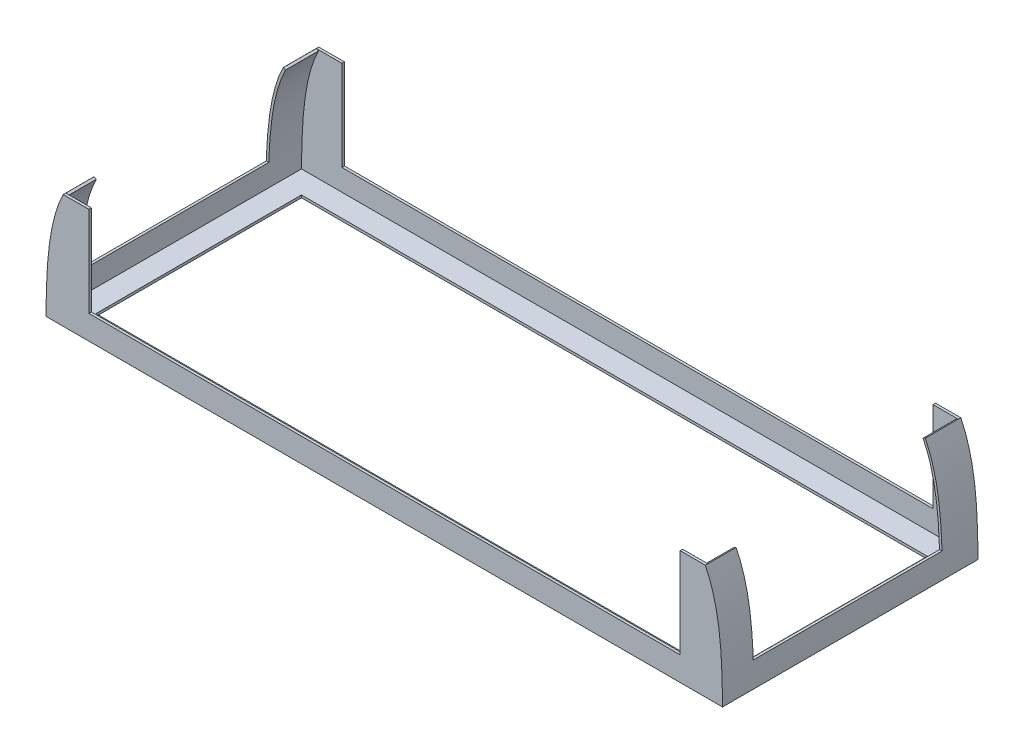
from build123d import *

# Parameters (mm, degrees)
EXTRUDE_THIN2_START    = -127
EXTRUDE_THIN2_DEPTH    = 254
SPLIT1_SURFACE_1_BACK  = 741.713
SPLIT1_SURFACE_1_DEPTH = 1483.426
BOSS_EXTRUDE2_DEPTH    = 2.54
BOSS_EXTRUDE3_DEPTH    = 2.54
SPLIT2_SURFACE_2_BACK  = 743.47
SPLIT2_SURFACE_2_DEPTH = 1486.94


# Read off the part's stored shape, not the designer's step: Extrude-Thin2
with BuildPart() as part:
    # Extrude-Thin2 outline → Extrude-Thin2 (new body)
    with BuildSketch(Plane.XY.offset(EXTRUDE_THIN2_START)):
        with BuildLine():
            Line((-325.542449195, 166.687822519), (-325.542449195, 166.669160537))
            Line((-325.542449195, 166.669160537), (-325.579794085, 166.687822519))
            add(Edge.make_bspline(
                [(-343.046678298, 50.863822519), (-342.854742326, 95.850869045), (-340.503085509, 136.824505781), (-325.579794085, 166.687822519)],
                knots=[0.396009693, 0.396009693, 0.396009693, 0.396009693, 0.524743478, 0.524743478, 0.524743478, 0.524743478], degree=3))
            Line((-343.046678298, 50.863822519), (343.046678298, 50.863822519))
            add(Edge.make_bspline(
                [(325.579794084, 166.687822519), (340.503085509, 136.824505781), (342.854742326, 95.850869045), (343.046678298, 50.863822519)],
                knots=[0.396009693, 0.396009693, 0.396009693, 0.396009693, 0.524743478, 0.524743478, 0.524743478, 0.524743478], degree=3))
            Line((325.579794084, 166.687822519), (323.307694442, 165.552409283))
            add(Edge.make_bspline(
                [(323.307694442, 165.552409283), (326.877593275, 158.408608594), (329.727019011, 150.576977672), (334.257221566, 133.733582984), (335.93764666, 124.722865717), (339.652297398, 96.250136339), (340.357498858, 75.350575466), (340.493401884, 53.403822519)],
                knots=[0, 0, 0, 0, 0.25, 0.25, 0.5, 0.5, 1, 1, 1, 1], degree=3))
            Line((340.493401884, 53.403822519), (-340.493401884, 53.403822519))
            add(Edge.make_bspline(
                [(-340.493401884, 53.403822519), (-340.357498858, 75.350575466), (-339.652297398, 96.250136339), (-335.937646661, 124.722865717), (-334.257221567, 133.733582984), (-329.727019012, 150.576977672), (-326.877593276, 158.408608594), (-323.307694443, 165.552409283)],
                knots=[0, 0, 0, 0, 0.5, 0.5, 0.75, 0.75, 1, 1, 1, 1], degree=3))
            Line((-323.307694443, 165.552409283), (-325.502746425, 166.649320276))
            Line((-325.502746425, 166.649320276), (-325.502746425, 166.687822519))
            Line((-325.502746425, 166.687822519), (-325.542449195, 166.687822519))
        make_face()
    extrude(amount=EXTRUDE_THIN2_DEPTH)

    # Split1: cut with a surface, the side behind it stays
    # Split1 surface: a surface, the sketch's curves swept straight by 1483.426 mm
    with BuildLine(Plane(origin=(0, 0, 0), x_dir=(0, 0, -1), z_dir=(1, 0, 0)).offset(-SPLIT1_SURFACE_1_BACK), mode=Mode.PRIVATE) as split1_surface_1_path:
        Line((-98.324088945, 166.687822519), (-97.98299712, 76.193733858))
        Line((-97.98299712, 76.193733858), (93.487324748, 76.104761498))
        Line((93.487324748, 76.104761498), (93.541066072, 166.687822519))
        Line((93.541066072, 166.687822519), (-98.324088945, 166.687822519))
    split1_surface_1 = Shell.extrude(split1_surface_1_path.wire(), (1 * SPLIT1_SURFACE_1_DEPTH, 0 * SPLIT1_SURFACE_1_DEPTH, 0 * SPLIT1_SURFACE_1_DEPTH))
    split(bisect_by=split1_surface_1, keep=Keep.BOTTOM)

    # Sketch6 → Boss-Extrude2 (add)
    with BuildSketch(Plane.XY.offset(129.54)):
        with BuildLine():
            Line((343.046678298, 50.863822519), (-343.046678298, 50.863822519))
            add(Edge.make_bspline(
                [(-325.579794085, 166.687822519), (-340.503085509, 136.824505781), (-342.854742326, 95.850869045), (-343.046678298, 50.863822519)],
                knots=[0.396009693, 0.396009693, 0.396009693, 0.396009693, 0.524743478, 0.524743478, 0.524743478, 0.524743478], degree=3))
            Line((-325.579794085, 166.687822519), (-325.542449195, 166.687822519))
            Line((-325.542449195, 166.687822519), (-299.506767133, 166.687822519))
            Line((-299.506767133, 166.687822519), (-299.506767133, 75.23611572))
            Line((-299.506767133, 75.23611572), (300.062358087, 75.23611572))
            Line((300.062358087, 75.23611572), (300.062358087, 166.687822519))
            Line((300.062358087, 166.687822519), (325.579794084, 166.687822519))
            add(Edge.make_bspline(
                [(325.579794084, 166.687822519), (340.503085509, 136.824505781), (342.854742326, 95.850869045), (343.046678298, 50.863822519)],
                knots=[0.396009693, 0.396009693, 0.396009693, 0.396009693, 0.524743478, 0.524743478, 0.524743478, 0.524743478], degree=3))
        make_face()
    extrude(amount=-BOSS_EXTRUDE2_DEPTH)

    # Sketch7 → Boss-Extrude3 (add)
    with BuildSketch(Plane(origin=(0, 0, -129.54), x_dir=(-1, 0, 0), z_dir=(0, 0, -1))):
        with BuildLine():
            Line((0, 50.863822519), (0, 75.23611572))
            Line((0, 75.23611572), (-300.062358087, 75.23611572))
            Line((-300.062358087, 75.23611572), (-300.062358087, 166.687822519))
            Line((-300.062358087, 166.687822519), (-325.502746425, 166.687822519))
            Line((-325.502746425, 166.687822519), (-325.542449195, 166.687822519))
            Line((-325.542449195, 166.687822519), (-325.579794085, 166.687822519))
            add(Edge.make_bspline(
                [(-325.579794085, 166.687822519), (-340.503085509, 136.824505781), (-342.854742326, 95.850869045), (-343.046678298, 50.863822519)],
                knots=[0.396009693, 0.396009693, 0.396009693, 0.396009693, 0.524743478, 0.524743478, 0.524743478, 0.524743478], degree=3))
            Line((-343.046678298, 50.863822519), (0, 50.863822519))
        make_face()
        with BuildLine():
            Line((299.506767133, 75.23611572), (0, 75.23611572))
            Line((0, 75.23611572), (0, 50.863822519))
            Line((0, 50.863822519), (343.046678298, 50.863822519))
            add(Edge.make_bspline(
                [(325.579794084, 166.687822519), (340.503085509, 136.824505781), (342.854742326, 95.850869045), (343.046678298, 50.863822519)],
                knots=[0.396009693, 0.396009693, 0.396009693, 0.396009693, 0.524743478, 0.524743478, 0.524743478, 0.524743478], degree=3))
            Line((325.579794084, 166.687822519), (299.506767133, 166.687822519))
            Line((299.506767133, 166.687822519), (299.506767133, 75.23611572))
        make_face()
    extrude(amount=-BOSS_EXTRUDE3_DEPTH)

    # Split2: cut with a surface, the side it looks to stays
    # Split2 surface: a surface, the sketch's curves swept straight by 1486.94 mm
    with BuildLine(Plane(origin=(0, 0, 0), x_dir=(1, 0, 0), z_dir=(0, 1, 0)).offset(-SPLIT2_SURFACE_2_BACK), mode=Mode.PRIVATE) as split2_surface_2_path:
        Line((-317.646678298, 104.14), (317.080123639, 104.14))
        Line((317.080123639, 104.14), (317.080123639, -104.14))
        Line((317.080123639, -104.14), (-317.646678298, -104.14))
        Line((-317.646678298, -104.14), (-317.646678298, 104.14))
    split2_surface_2 = Shell.extrude(split2_surface_2_path.wire(), (0 * SPLIT2_SURFACE_2_DEPTH, 1 * SPLIT2_SURFACE_2_DEPTH, 0 * SPLIT2_SURFACE_2_DEPTH))
    split(bisect_by=split2_surface_2, keep=Keep.TOP)


solid = part.part
